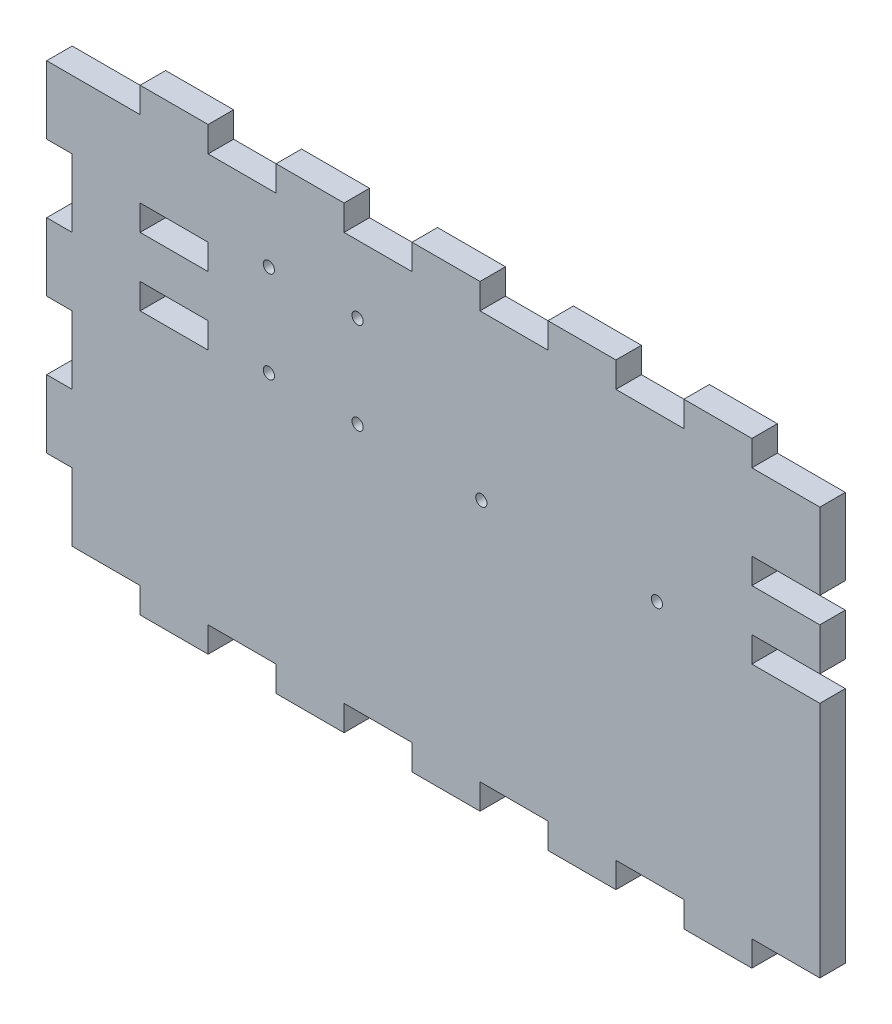
from build123d import *

# Parameters (mm, degrees)
SKETCH1_W               = 279.4
SKETCH1_H               = 152.4
BOSS_EXTRUDE1_DEPTH     = 9.525
SKETCH2_W               = 25.4
SKETCH2_H               = 9.525
BOSS_EXTRUDE2_DEPTH     = 9.525
LPATTERN1_COUNT         = 5
LPATTERN1_PITCH         = 50.8
MIRROR1_COPY_1_SKETCH_W = 25.4
MIRROR1_COPY_1_SKETCH_H = 9.525
MIRROR1_COPY_1_DEPTH    = 9.525
MIRROR1_COPY_2_SKETCH_W = 25.4
MIRROR1_COPY_2_SKETCH_H = 9.525
MIRROR1_COPY_2_DEPTH    = 9.525
MIRROR1_COPY_3_SKETCH_W = 25.4
MIRROR1_COPY_3_SKETCH_H = 9.525
MIRROR1_COPY_3_DEPTH    = 9.525
MIRROR1_COPY_4_SKETCH_W = 25.4
MIRROR1_COPY_4_SKETCH_H = 9.525
MIRROR1_COPY_4_DEPTH    = 9.525
MIRROR1_COPY_5_SKETCH_W = 25.4
MIRROR1_COPY_5_SKETCH_H = 9.525
MIRROR1_COPY_5_DEPTH    = 9.525
SKETCH3_W               = 9.525
SKETCH3_H               = 25.4
BOSS_EXTRUDE3_DEPTH     = 9.525
LPATTERN2_COUNT         = 3
LPATTERN2_PITCH         = 50.8
SKETCH4_W               = 25.4
SKETCH4_H               = 9.525
CUT_EXTRUDE1_DEPTH      = 173.358933261
LPATTERN3_COUNT         = 2
LPATTERN3_PITCH         = 228.6
SKETCH5_W               = 25.4
SKETCH5_H               = 9.525
CUT_EXTRUDE2_DEPTH      = 173.358933261
LPATTERN4_COUNT         = 2
LPATTERN4_PITCH         = 228.6
SKETCH6_R               = 2.1
CUT_EXTRUDE3_DEPTH      = 173.358933261


with BuildPart() as part:
    # Sketch1 → Boss-Extrude1 (new body)
    with BuildSketch(Plane.XY):
        Rectangle(SKETCH1_W, SKETCH1_H)
    extrude(amount=BOSS_EXTRUDE1_DEPTH)

    # Sketch2 → Boss-Extrude2 (add)
    with BuildSketch(Plane.XZ.offset(76.2)):
        with Locations((-101.6, 4.7625)):
            Rectangle(SKETCH2_W, SKETCH2_H)
    boss_extrude2 = extrude(amount=BOSS_EXTRUDE2_DEPTH)

    # LPattern1: Boss-Extrude2 ×5
    with Locations(*[(i * LPATTERN1_PITCH, 0, 0) for i in range(1, LPATTERN1_COUNT)]):
        add(boss_extrude2)

    # Mirror1 copy 1 sketch → Mirror1 copy 1 (add)
    with BuildSketch(Plane(origin=(50.8, 76.2, 0), x_dir=(1, 0, 0), z_dir=(0, 1, 0))):
        with Locations((-101.6, -4.7625)):
            Rectangle(MIRROR1_COPY_1_SKETCH_W, MIRROR1_COPY_1_SKETCH_H)
    extrude(amount=MIRROR1_COPY_1_DEPTH)

    # Mirror1 copy 2 sketch → Mirror1 copy 2 (add)
    with BuildSketch(Plane(origin=(101.6, 76.2, 0), x_dir=(1, 0, 0), z_dir=(0, 1, 0))):
        with Locations((-101.6, -4.7625)):
            Rectangle(MIRROR1_COPY_2_SKETCH_W, MIRROR1_COPY_2_SKETCH_H)
    extrude(amount=MIRROR1_COPY_2_DEPTH)

    # Mirror1 copy 3 sketch → Mirror1 copy 3 (add)
    with BuildSketch(Plane(origin=(152.4, 76.2, 0), x_dir=(1, 0, 0), z_dir=(0, 1, 0))):
        with Locations((-101.6, -4.7625)):
            Rectangle(MIRROR1_COPY_3_SKETCH_W, MIRROR1_COPY_3_SKETCH_H)
    extrude(amount=MIRROR1_COPY_3_DEPTH)

    # Mirror1 copy 4 sketch → Mirror1 copy 4 (add)
    with BuildSketch(Plane(origin=(203.2, 76.2, 0), x_dir=(1, 0, 0), z_dir=(0, 1, 0))):
        with Locations((-101.6, -4.7625)):
            Rectangle(MIRROR1_COPY_4_SKETCH_W, MIRROR1_COPY_4_SKETCH_H)
    extrude(amount=MIRROR1_COPY_4_DEPTH)

    # Mirror1 copy 5 sketch → Mirror1 copy 5 (add)
    with BuildSketch(Plane(origin=(0, 76.2, 0), x_dir=(1, 0, 0), z_dir=(0, 1, 0))):
        with Locations((-101.6, -4.7625)):
            Rectangle(MIRROR1_COPY_5_SKETCH_W, MIRROR1_COPY_5_SKETCH_H)
    extrude(amount=MIRROR1_COPY_5_DEPTH)

    # Sketch3 → Boss-Extrude3 (add)
    with BuildSketch(Plane.ZY.offset(139.7)):
        with Locations((4.7625, 63.5)):
            Rectangle(SKETCH3_W, SKETCH3_H)
    boss_extrude3 = extrude(amount=BOSS_EXTRUDE3_DEPTH)

    # LPattern2: Boss-Extrude3 ×3
    with Locations(*[(0, -i * LPATTERN2_PITCH, 0) for i in range(1, LPATTERN2_COUNT)]):
        add(boss_extrude3)

    # Sketch4 → Cut-Extrude1 (cut, through all)
    with BuildSketch(Plane(origin=(0, 0, 0), x_dir=(-1, 0, 0), z_dir=(0, 0, -1))):
        with Locations((-127, 17.4625)):
            Rectangle(SKETCH4_W, SKETCH4_H)
    cut_extrude1 = extrude(amount=-CUT_EXTRUDE1_DEPTH, mode=Mode.SUBTRACT)

    # LPattern3: Cut-Extrude1 ×2
    with Locations(*[(-i * LPATTERN3_PITCH, 0, 0) for i in range(1, LPATTERN3_COUNT)]):
        add(cut_extrude1, mode=Mode.SUBTRACT)

    # Sketch5 → Cut-Extrude2 (cut, through all)
    with BuildSketch(Plane.XY.offset(9.525)):
        with Locations((-101.6, 42.8625)):
            Rectangle(SKETCH5_W, SKETCH5_H)
    cut_extrude2 = extrude(amount=-CUT_EXTRUDE2_DEPTH, mode=Mode.SUBTRACT)

    # LPattern4: Cut-Extrude2 ×2
    with Locations(*[(i * LPATTERN4_PITCH, 0, 0) for i in range(1, LPATTERN4_COUNT)]):
        add(cut_extrude2, mode=Mode.SUBTRACT)

    # Sketch6 → Cut-Extrude3 (cut, through all)
    with BuildSketch(Plane(origin=(0, 0, 0), x_dir=(-1, 0, 0), z_dir=(0, 0, -1))):
        with Locations((-78.811081859, 15.175)):
            Circle(SKETCH6_R)
        with Locations((-13.203881859, 15.175)):
            Circle(SKETCH6_R)
        with Locations((66.195004141, 16.68377)):
            Circle(SKETCH6_R)
        with Locations((33.045004141, 50.945)):
            Circle(SKETCH6_R)
        with Locations((66.195004141, 50.945)):
            Circle(SKETCH6_R)
        with Locations((33.045004141, 16.68377)):
            Circle(SKETCH6_R)
    extrude(amount=-CUT_EXTRUDE3_DEPTH, mode=Mode.SUBTRACT)


solid = part.part
